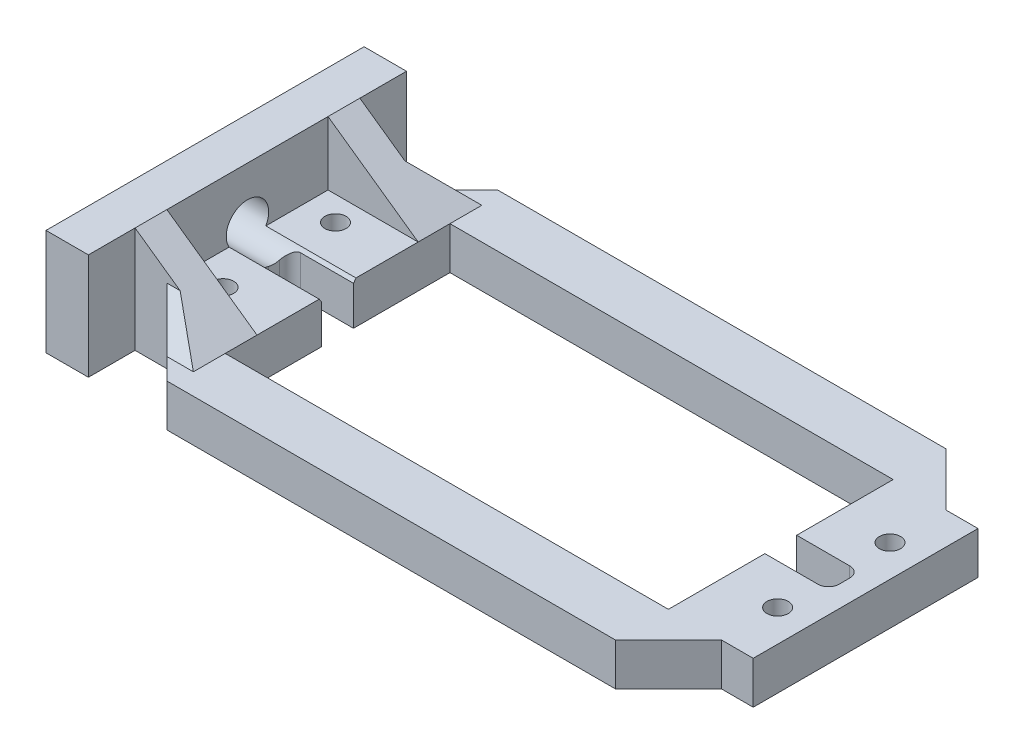
from build123d import *

# Parameters (mm, degrees)
SKETCH1_R           = 1
BOSS_EXTRUDE1_DEPTH = 4
FILLET1_R           = 1
SKETCH2_W           = 30
SKETCH2_H           = 10
BOSS_EXTRUDE2_DEPTH = 4
SKETCH3_W           = 8.5
SKETCH3_H           = 3
BOSS_EXTRUDE3_DEPTH = 6
CUT_EXTRUDE1_DEPTH  = 44.611924975
CHAMFER3_SIZE       = 3
CUT_EXTRUDE2_REACH  = 66.997
SKETCH5_R           = 2


with BuildPart() as part:
    # Sketch1 → Boss-Extrude1 (new body)
    with BuildSketch(Plane(origin=(0, 0, 0), x_dir=(1, 0, 0), z_dir=(0, 1, 0))):
        Polygon((-21.4, 15.6), (-26.4, 10.6), (-29.4, 10.6), (-29.4, -10.6), (-26.4, -10.6), (-21.4, -15.6), (20.9, -15.6), (25.9, -10.6), (28.9, -10.6), (28.9, 10.6), (25.9, 10.6), (20.9, 15.6), align=None)
        Polygon((20.9, -1.5), (20.9, -10.6), (-20.9, -10.6), (-20.9, -1.5), (-26.9, -1.5), (-26.9, 1.5), (-20.9, 1.5), (-20.9, 10.6), (20.9, 10.6), (20.9, 1.5), (26.9, 1.5), (26.9, -1.5), align=None, mode=Mode.SUBTRACT)
        with Locations(Location((-26.4, 5.3, 0), (0, 0, 270))):
            Circle(SKETCH1_R, mode=Mode.SUBTRACT)
        with Locations(Location((-26.4, -5.3, 0), (0, 0, 270))):
            Circle(SKETCH1_R, mode=Mode.SUBTRACT)
        with Locations(Location((25.9, -5.3, 0), (0, 0, 270))):
            Circle(SKETCH1_R, mode=Mode.SUBTRACT)
        with Locations(Location((25.9, 5.3, 0), (0, 0, 270))):
            Circle(SKETCH1_R, mode=Mode.SUBTRACT)
    extrude(amount=BOSS_EXTRUDE1_DEPTH)

    # Fillet1
    fillet1_edges = [part.edges().sort_by_distance(p)[0] for p in [
        (26.9, 2, 1.5),
        (26.9, 2, -1.5),
        (-26.9, 2, -1.5),
        (-26.9, 2, 1.5),
    ]]
    fillet(fillet1_edges, radius=FILLET1_R)

    # Sketch2 → Boss-Extrude2 (add)
    with BuildSketch(Plane.ZY.offset(29.4)):
        with Locations((0, 5)):
            Rectangle(SKETCH2_W, SKETCH2_H)
    extrude(amount=BOSS_EXTRUDE2_DEPTH)

    # Sketch3 → Boss-Extrude3 (add)
    with BuildSketch(Plane(origin=(0, 4, 0), x_dir=(1, 0, 0), z_dir=(0, 1, 0))):
        with Locations((-25.15, -9.1)):
            Rectangle(SKETCH3_W, SKETCH3_H)
        with Locations((-25.15, 9.1)):
            Rectangle(SKETCH3_W, SKETCH3_H)
    extrude(amount=BOSS_EXTRUDE3_DEPTH)

    # Sketch4 → Cut-Extrude1 (cut, through all)
    with BuildSketch(Plane(origin=(0, 0, -10.6), x_dir=(-1, 0, 0), z_dir=(0, 0, -1))):
        Polygon((20.9, 4), (29.4, 10), (20.9, 10), align=None)
    extrude(amount=-CUT_EXTRUDE1_DEPTH, mode=Mode.SUBTRACT)

    # Chamfer3
    # the kernel refuses this chamfer: 3 mm, written as the material it adds along each edge
    with BuildSketch(Plane(origin=(-13.184951036, 4, 10.6), x_dir=(0, -0.02749587661058635, 0.9996219169112968), z_dir=(-1, 0, 0))) as chamfer3_piece_1_section:
        Polygon((CHAMFER3_SIZE * 0.999621916911, CHAMFER3_SIZE * 0.0274958766106), (-CHAMFER3_SIZE * 0.0274958766106, CHAMFER3_SIZE * 0.999621916911), (0, 0), align=None)
    chamfer3_piece_1 = extrude(amount=20.930097928, mode=Mode.PRIVATE)
    chamfer3_piece_1 = split(chamfer3_piece_1, bisect_by=Plane(origin=(-24.611993243, 4.851351351, 12.388006757), z_dir=(0.7071067811865483, 0, -0.7071067811865467)), keep=Keep.TOP, mode=Mode.PRIVATE)
    chamfer3_piece_1 = split(chamfer3_piece_1, bisect_by=Plane(origin=(-23.221105892, 5.638427689, 11.552702703), z_dir=(-0.5766831975986547, -0.8169678632647621, 0)), keep=Keep.TOP, mode=Mode.PRIVATE)
    add(chamfer3_piece_1)
    with BuildSketch(Plane(origin=(-13.184951036, 4, -10.6), x_dir=(-1.6712331566303747e-15, -0.02749587661058635, -0.9996219169112968), z_dir=(-1, 0, 0))) as chamfer3_piece_2_section:
        Polygon((CHAMFER3_SIZE * 0.999621916911, -CHAMFER3_SIZE * 0.0274958766106), (-CHAMFER3_SIZE * 0.0274958766106, -CHAMFER3_SIZE * 0.999621916911), (0, 0), align=None)
    chamfer3_piece_2 = extrude(amount=20.930097928, mode=Mode.PRIVATE)
    chamfer3_piece_2 = split(chamfer3_piece_2, bisect_by=Plane(origin=(-24.611993243, 4.851351351, -12.388006757), z_dir=(0.7071067811865487, 0, 0.7071067811865465)), keep=Keep.TOP, mode=Mode.PRIVATE)
    chamfer3_piece_2 = split(chamfer3_piece_2, bisect_by=Plane(origin=(-23.221105892, 5.638427689, -11.552702703), z_dir=(-0.5766831975986547, -0.8169678632647621, 0)), keep=Keep.TOP, mode=Mode.PRIVATE)
    add(chamfer3_piece_2)

    # Sketch5 → Cut-Extrude2 (cut, up to next)
    with BuildSketch(Plane.ZY.offset(33.4), mode=Mode.PRIVATE) as cut_extrude2_sk1:
        with Locations((0, 5)):
            Circle(SKETCH5_R)
    cut_extrude2_tool1 = extrude(cut_extrude2_sk1.sketch, amount=-CUT_EXTRUDE2_REACH, mode=Mode.PRIVATE) & part.part
    add(cut_extrude2_tool1.solids().sort_by_distance((-33.4, 5, 0))[0], mode=Mode.SUBTRACT)


solid = part.part
